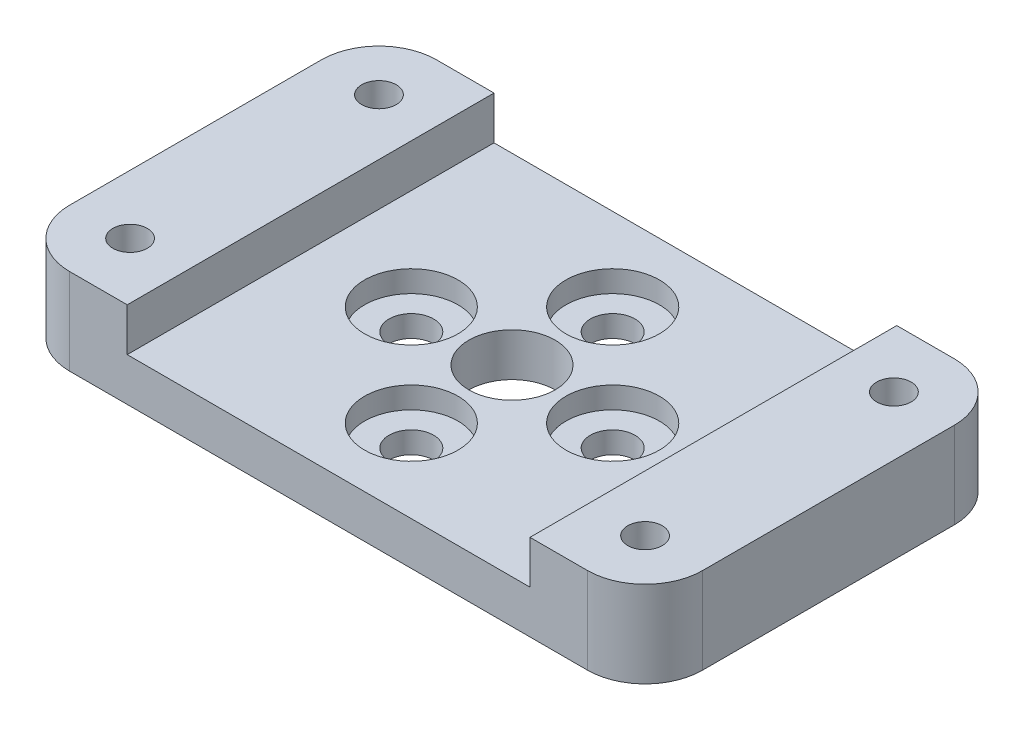
from build123d import *

# Parameters (mm, degrees)
SKETCH_1_R          = 1.5500000000000003
SKETCH_1_R_2        = 1.55
SKETCH_1_R_3        = 1.2000000000000004
SKETCH_1_R_4        = 3
EXTRUDE_1_DEPTH     = 3
SKETCH_3_R          = 1.2000000000000004
EXTRUDE_2_DEPTH     = 6
FILLET_1_R          = 4
SKETCH_2_R          = 3.25
SKETCH_2_R_2        = 3.2500000000000004
CUT_EXTRUDE_1_DEPTH = 1.5
CHAMFER_1_SIZE      = 1.5


with BuildPart() as part:
    # 草图1 → 凸台-拉伸1 (new body)
    with BuildSketch(Plane(origin=(0, 0, 0), x_dir=(1, 0, 0), z_dir=(0, 1, 0))):
        Polygon((21.999999999999996, -12.749999999999998), (-22.000000000000004, -12.750000000000002), (-22.000000000000004, 12.749999999999996), (21.999999999999996, 12.750000000000002), align=None)
        with Locations((7, 0)):
            Circle(SKETCH_1_R, mode=Mode.SUBTRACT)
        with Locations((-2.444e-14, -7)):
            Circle(SKETCH_1_R_2, mode=Mode.SUBTRACT)
        with Locations((-7, 4.888e-14)):
            Circle(SKETCH_1_R, mode=Mode.SUBTRACT)
        with Locations((7.332e-14, 7.000000000000001)):
            Circle(SKETCH_1_R_2, mode=Mode.SUBTRACT)
        with Locations((-17.900000000000002, 8.65)):
            Circle(SKETCH_1_R_3, mode=Mode.SUBTRACT)
        with Locations((17.899999999999995, 8.650000000000006)):
            Circle(SKETCH_1_R_3, mode=Mode.SUBTRACT)
        with Locations((-17.900000000000002, -8.65)):
            Circle(SKETCH_1_R_3, mode=Mode.SUBTRACT)
        with Locations((17.899999999999995, -8.650000000000006)):
            Circle(SKETCH_1_R_3, mode=Mode.SUBTRACT)
        Circle(SKETCH_1_R_4, mode=Mode.SUBTRACT)
    extrude(amount=EXTRUDE_1_DEPTH)

    # 草图3 → 凸台-拉伸2 (add)
    # profile 1 of 2: a face of its own
    with BuildSketch(Plane.XZ):
        Polygon((-22.000000000000004, 12.750000000000002), (-14.000000000000002, 12.750000000000002), (-14.000000000000002, -12.750000000000002), (-22.000000000000004, -12.749999999999998), align=None)
        with Locations((-17.900000000000002, -8.65)):
            Circle(SKETCH_3_R, mode=Mode.SUBTRACT)
        with Locations((-17.900000000000002, 8.65)):
            Circle(SKETCH_3_R, mode=Mode.SUBTRACT)
    # profile 2 of 2: a face of its own
    with BuildSketch(Plane.XZ):
        Polygon((22.000000000000004, -12.749999999999998), (14.000000000000002, -12.750000000000002), (14.000000000000002, 12.750000000000002), (22.000000000000004, 12.750000000000002), align=None)
        with Locations((17.899999999999995, -8.650000000000006)):
            Circle(SKETCH_3_R, mode=Mode.SUBTRACT)
        with Locations((17.899999999999995, 8.650000000000006)):
            Circle(SKETCH_3_R, mode=Mode.SUBTRACT)
    extrude(amount=-EXTRUDE_2_DEPTH)

    # 圆角1
    fillet_1_edges = [part.edges().sort_by_distance(p)[0] for p in [
        (-22.000000000000004, 4.5, -12.749999999999998),
        (-22.000000000000004, 4.5, 12.750000000000002),
        (22, 3, 12.75),
        (22, 3, -12.75),
    ]]
    fillet(fillet_1_edges, radius=FILLET_1_R)

    # 草图2 → 切除-拉伸1 (cut)
    with BuildSketch(Plane(origin=(0, 3, 0), x_dir=(1, 0, 0), z_dir=(0, 1, 0))):
        with Locations((7, 0)):
            Circle(SKETCH_2_R)
        with Locations((-2.444e-14, -7)):
            Circle(SKETCH_2_R)
        with Locations((-7, 4.888e-14)):
            Circle(SKETCH_2_R)
        with Locations((7.332e-14, 7.000000000000001)):
            Circle(SKETCH_2_R_2)
    extrude(amount=-CUT_EXTRUDE_1_DEPTH, mode=Mode.SUBTRACT)

    # 倒角1
    chamfer_1_edges = [part.edges().sort_by_distance(p)[0] for p in [
        (16.699999999999996, 0, -8.650000000000006),
        (16.699999999999996, 0, 8.650000000000006),
        (-19.1, 0, 8.65),
        (-19.1, 0, -8.65),
    ]]
    chamfer(chamfer_1_edges, length=CHAMFER_1_SIZE)


solid = part.part
